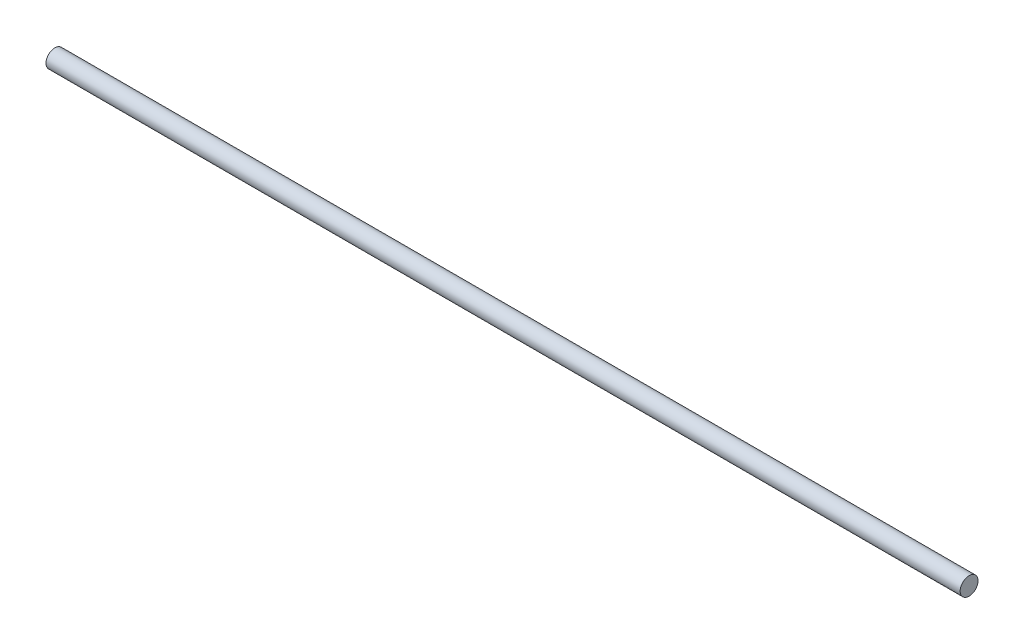
from build123d import *

# Parameters (mm, degrees)
SKETCH3_R           = 4
BOSS_EXTRUDE1_DEPTH = 410


with BuildPart() as part:
    # Sketch3 → Boss-Extrude1 (new body)
    with BuildSketch(Plane(origin=(0, 0, 0), x_dir=(0, 0, -1), z_dir=(1, 0, 0))):
        Circle(SKETCH3_R)
    extrude(amount=BOSS_EXTRUDE1_DEPTH)


solid = part.part
